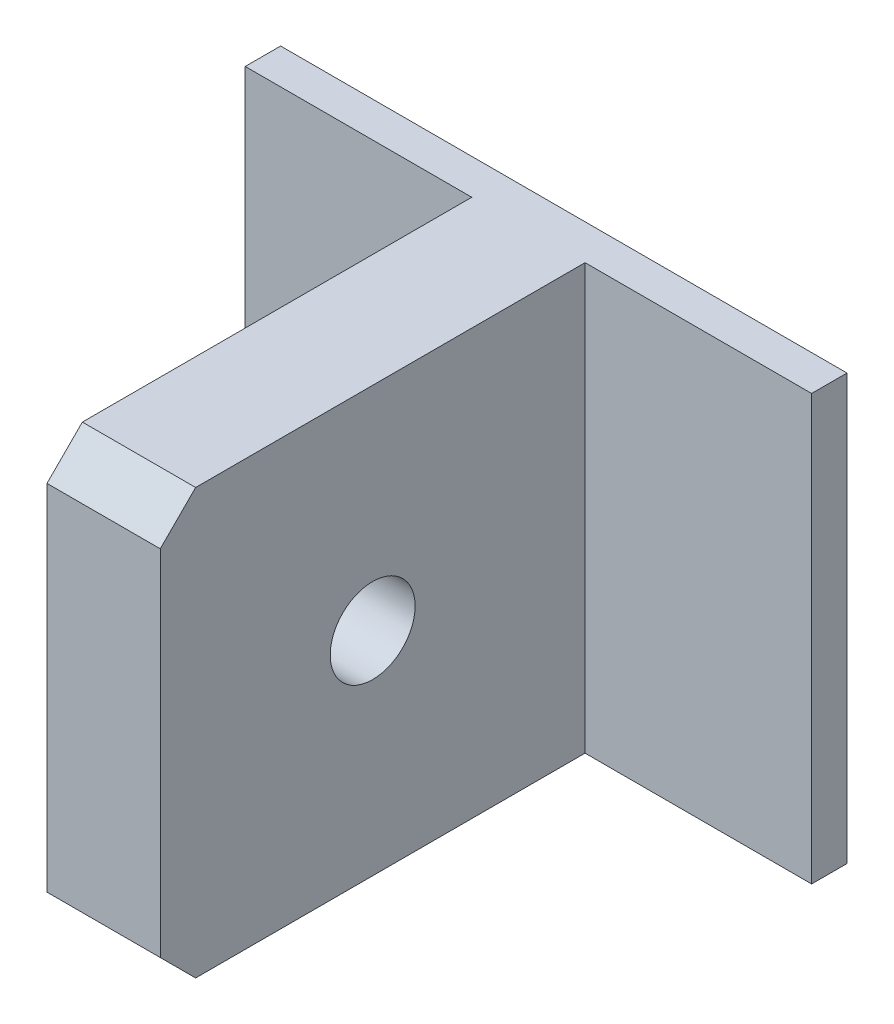
from build123d import *

# Parameters (mm, degrees)
CROQUIS3_W              = 80
CROQUIS3_H              = 60
SALIENTE_EXTRUIR1_DEPTH = 5
CROQUIS3_4_W            = 16
CROQUIS3_4_H            = 60
SALIENTE_EXTRUIR2_DEPTH = 60
CHAFL_N1_SIZE           = 5
CROQUIS4_R              = 6
CORTAR_EXTRUIR1_DEPTH   = 60
CHAFL_N2_SIZE           = 5


with BuildPart() as part:
    # Croquis3 → Saliente-Extruir1 (new body)
    with BuildSketch(Plane.XY):
        Rectangle(CROQUIS3_W, CROQUIS3_H)
    extrude(amount=-SALIENTE_EXTRUIR1_DEPTH)

    # Croquis3<4> → Saliente-Extruir2 (add)
    with BuildSketch(Plane.XY):
        Rectangle(CROQUIS3_4_W, CROQUIS3_4_H)
    extrude(amount=SALIENTE_EXTRUIR2_DEPTH)

    # Chaflán1
    chafl_n1_edges = [part.edges().sort_by_distance(p)[0] for p in [
        (0, 30, 60),
    ]]
    chamfer(chafl_n1_edges, length=CHAFL_N1_SIZE)

    # Croquis4 → Cortar-Extruir1 (cut)
    with BuildSketch(Plane(origin=(8, 0, 0), x_dir=(0, 0, -1), z_dir=(1, 0, 0))):
        with Locations((-30, 0)):
            Circle(CROQUIS4_R)
    extrude(amount=-CORTAR_EXTRUIR1_DEPTH, mode=Mode.SUBTRACT)

    # Chaflán2
    chafl_n2_edges = [part.edges().sort_by_distance(p)[0] for p in [
        (0, -30, 60),
    ]]
    chamfer(chafl_n2_edges, length=CHAFL_N2_SIZE)


solid = part.part
